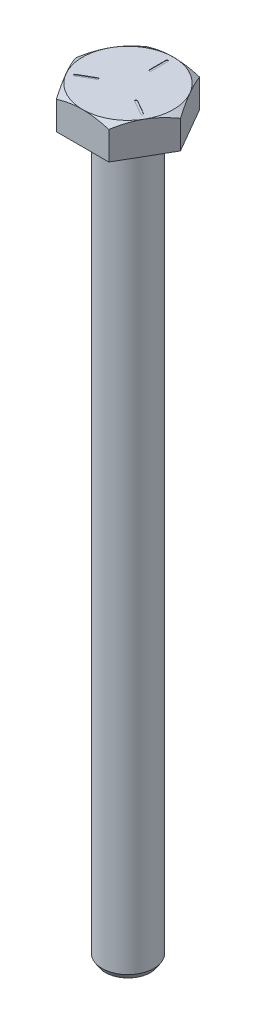
from build123d import *

# Parameters (mm, degrees)
BOSS_EXTRUDE1_DEPTH = 3.9624
CUT_EXTRUDE1_DEPTH  = 0.0508


with BuildPart() as part:
    # Sketch1 → Boss-Extrude1 (new body)
    with BuildSketch(Plane(origin=(0, 0, 0), x_dir=(1, 0, 0), z_dir=(0, 1, 0))):
        Polygon((6.415804866, 0), (3.207902433, 5.55625), (-3.207902433, 5.55625), (-6.415804866, 0), (-3.207902433, -5.55625), (3.207902433, -5.55625), align=None)
    extrude(amount=BOSS_EXTRUDE1_DEPTH)

    # Sketch2 → Cut-Revolve1 (revolve, cut)
    with BuildSketch(Plane.XY):
        Polygon((5.55625, 3.9624), (6.415804866, 3.4544), (6.415804866, 3.9624), align=None)
    revolve(axis=Axis((0, 0, 0), (0, 1, 0)), mode=Mode.SUBTRACT)

    # Sketch3 → Cut-Extrude1 (cut)
    with BuildSketch(Plane(origin=(0, 3.9624, 0), x_dir=(-1, 0, 0), z_dir=(0, -1, 0))):
        with BuildLine():
            Line((0.127, 4.7625), (0.127, 2.7305))
            ThreePointArc((0.127, 2.7305), (0, 2.6035), (-0.127, 2.7305))
            Line((-0.127, 2.7305), (-0.127, 4.7625))
            ThreePointArc((-0.127, 4.7625), (0, 4.8895), (0.127, 4.7625))
        make_face()
        with BuildLine():
            Line((4.060945986, -2.491235226), (2.301182365, -1.475235226))
            ThreePointArc((2.301182365, -1.475235226), (2.254697139, -1.30175), (2.428182365, -1.255264774))
            Line((2.428182365, -1.255264774), (4.187945986, -2.271264774))
            ThreePointArc((4.187945986, -2.271264774), (4.234431212, -2.44475), (4.060945986, -2.491235226))
        make_face()
        with BuildLine():
            Line((-4.187945986, -2.271264774), (-2.428182365, -1.255264774))
            ThreePointArc((-2.428182365, -1.255264774), (-2.254697139, -1.30175), (-2.301182365, -1.475235226))
            Line((-2.301182365, -1.475235226), (-4.060945986, -2.491235226))
            ThreePointArc((-4.060945986, -2.491235226), (-4.234431212, -2.44475), (-4.187945986, -2.271264774))
        make_face()
    extrude(amount=CUT_EXTRUDE1_DEPTH, mode=Mode.SUBTRACT)

    # Bolt Length Sketch → Bolt Length (revolve)
    with BuildSketch(Plane.XY):
        Polygon((0, 0), (0, -88.9), (2.778125, -88.9), (3.175, -88.265), (3.175, 0), align=None)
    revolve(axis=Axis((0, 0, 0), (0, -1, 0)))


solid = part.part
